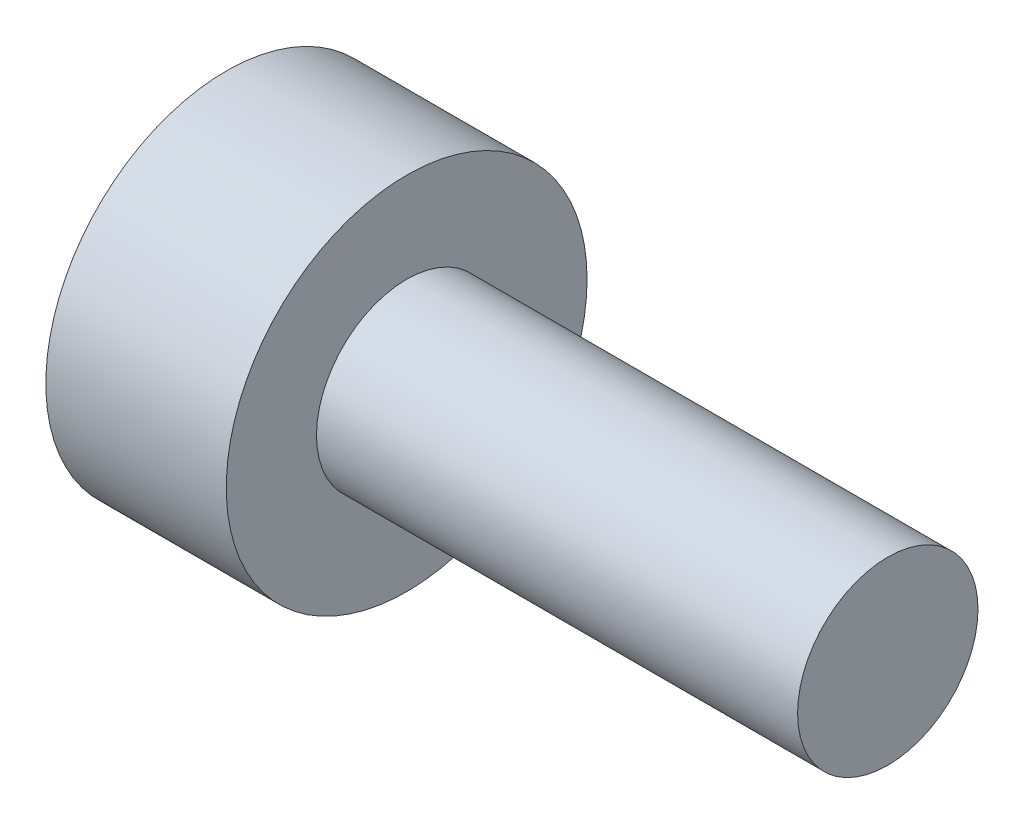
from build123d import *

# Parameters (mm, degrees)
SKETCH1_R           = 3
BOSS_EXTRUDE1_DEPTH = 3
SKETCH2_R           = 1.5
BOSS_EXTRUDE2_DEPTH = 8


with BuildPart() as part:
    # Sketch1 → Boss-Extrude1 (new body)
    with BuildSketch(Plane(origin=(0, 0, 0), x_dir=(0, 0, -1), z_dir=(1, 0, 0))):
        Circle(SKETCH1_R)
    extrude(amount=BOSS_EXTRUDE1_DEPTH)

    # Sketch2 → Boss-Extrude2 (add)
    with BuildSketch(Plane(origin=(3, 0, 0), x_dir=(0, 0, -1), z_dir=(1, 0, 0))):
        Circle(SKETCH2_R)
    extrude(amount=BOSS_EXTRUDE2_DEPTH)


solid = part.part
